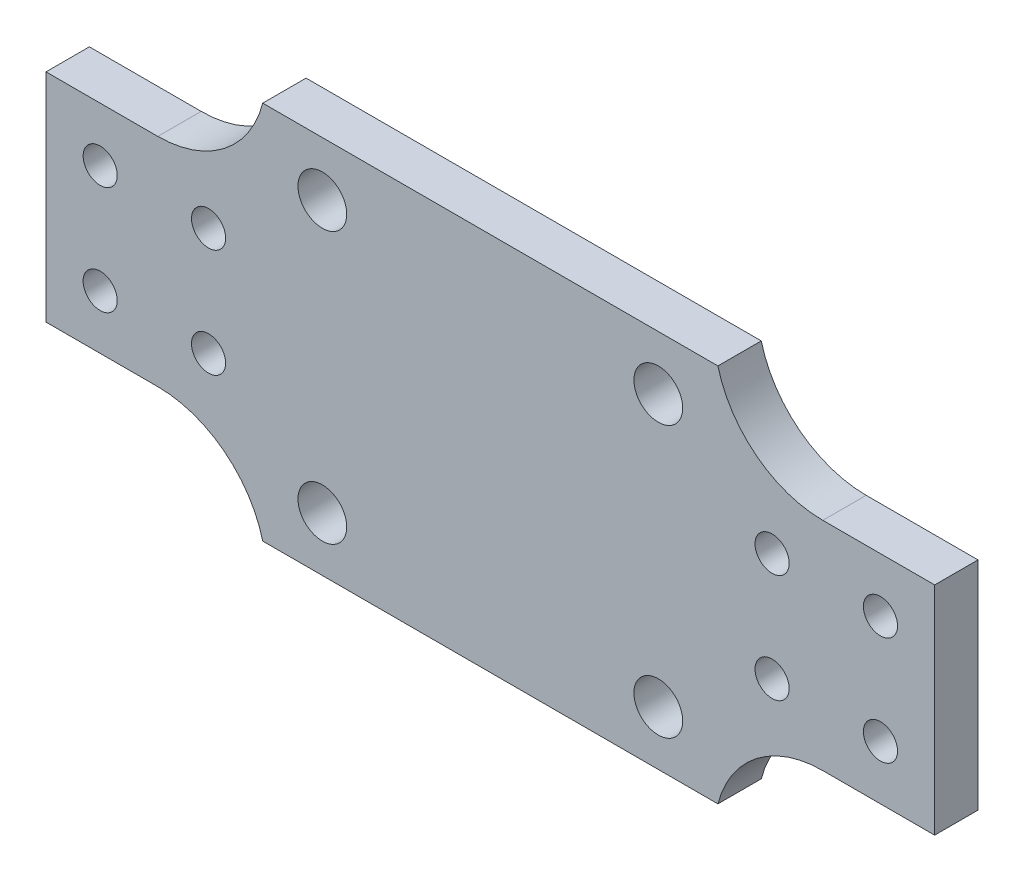
from build123d import *

# Parameters (mm, degrees)
SKETCH_1_W          = 82
SKETCH_1_H          = 20
EXTRUDE_1_DEPTH     = 4
SKETCH_2_W          = 42
SKETCH_2_H          = 35
EXTRUDE_2_DEPTH     = 4
SKETCH_3_R          = 1.575
SKETCH_3_R_2        = 2.25
CUT_EXTRUDE_1_DEPTH = 87.580887036
FILLET_1_R          = 10


with BuildPart() as part:
    # 草图1 → 凸台-拉伸1 (new body)
    with BuildSketch(Plane.XY):
        with Locations((41, -10)):
            Rectangle(SKETCH_1_W, SKETCH_1_H)
    extrude(amount=EXTRUDE_1_DEPTH)

    # 草图2 → 凸台-拉伸2 (add)
    with BuildSketch(Plane.XY.offset(4)):
        with Locations((41, -10)):
            Rectangle(SKETCH_2_W, SKETCH_2_H)
    extrude(amount=-EXTRUDE_2_DEPTH)

    # 草图3 → 切除-拉伸1 (cut, through all)
    with BuildSketch(Plane.XY.offset(4)):
        with Locations((5, -5)):
            Circle(SKETCH_3_R)
        with Locations(Location((15, -5, 0), (0, 0, 180))):
            Circle(SKETCH_3_R)
        with Locations((15, -15)):
            Circle(SKETCH_3_R)
        with Locations(Location((5, -15, 0), (0, 0, 180))):
            Circle(SKETCH_3_R)
        with Locations((77, -15)):
            Circle(SKETCH_3_R)
        with Locations(Location((67, -15, 0), (0, 0, 180))):
            Circle(SKETCH_3_R)
        with Locations((67, -5)):
            Circle(SKETCH_3_R)
        with Locations(Location((77, -5, 0), (0, 0, 180))):
            Circle(SKETCH_3_R)
        with Locations((25.5, 2.5)):
            Circle(SKETCH_3_R_2)
        with Locations(Location((56.5, 2.5, 0), (0, 0, 180))):
            Circle(SKETCH_3_R_2)
        with Locations((56.5, -22.5)):
            Circle(SKETCH_3_R_2)
        with Locations(Location((25.5, -22.5, 0), (0, 0, 180))):
            Circle(SKETCH_3_R_2)
    extrude(amount=-CUT_EXTRUDE_1_DEPTH, mode=Mode.SUBTRACT)

    # 圆角1
    # the kernel refuses this fillet: 10 mm, written as the material it adds along each edge
    with BuildSketch(Plane(origin=(62, -20, 4), x_dir=(0, -1, 0), z_dir=(0, 0, -1)), Plane(origin=(62, 0, 0), x_dir=(0, 1, 0), z_dir=(0, 0, 1))) as fillet_1_piece_1:
        with BuildLine():
            CenterArc((10, -9.682458366), FILLET_1_R, 104.477512186, 75.522487814)
            Line((0, -9.682458366), (-0.2, -9.682458366))
            Line((-0.2, -9.682458366), (-0.2, 0))
            Line((-0.2, 0), (0, 0.2))
            ThreePointArc((0, 0.2), (3.75, 0.2), (7.45, 0.193649167))
            Line((7.45, 0.193649167), (7.5, 0))
        make_face()
    extrude(amount=4)
    with BuildSketch(Plane(origin=(20, -20, 0), x_dir=(-1, 0, 0), z_dir=(0, 0, 1)), Plane(origin=(20, 0, 4), x_dir=(-1, 0, 0), z_dir=(0, 0, -1))) as fillet_1_piece_2:
        with BuildLine():
            CenterArc((9.682458366, 10), FILLET_1_R, 194.477512186, 75.522487814)
            Line((0, 7.5), (-0.193649167, 7.45))
            ThreePointArc((-0.193649167, 7.45), (-0.2, 3.75), (-0.2, 0))
            Line((-0.2, 0), (0, -0.2))
            Line((0, -0.2), (9.682458366, -0.2))
            Line((9.682458366, -0.2), (9.682458366, 0))
        make_face()
    extrude(amount=4)


solid = part.part
